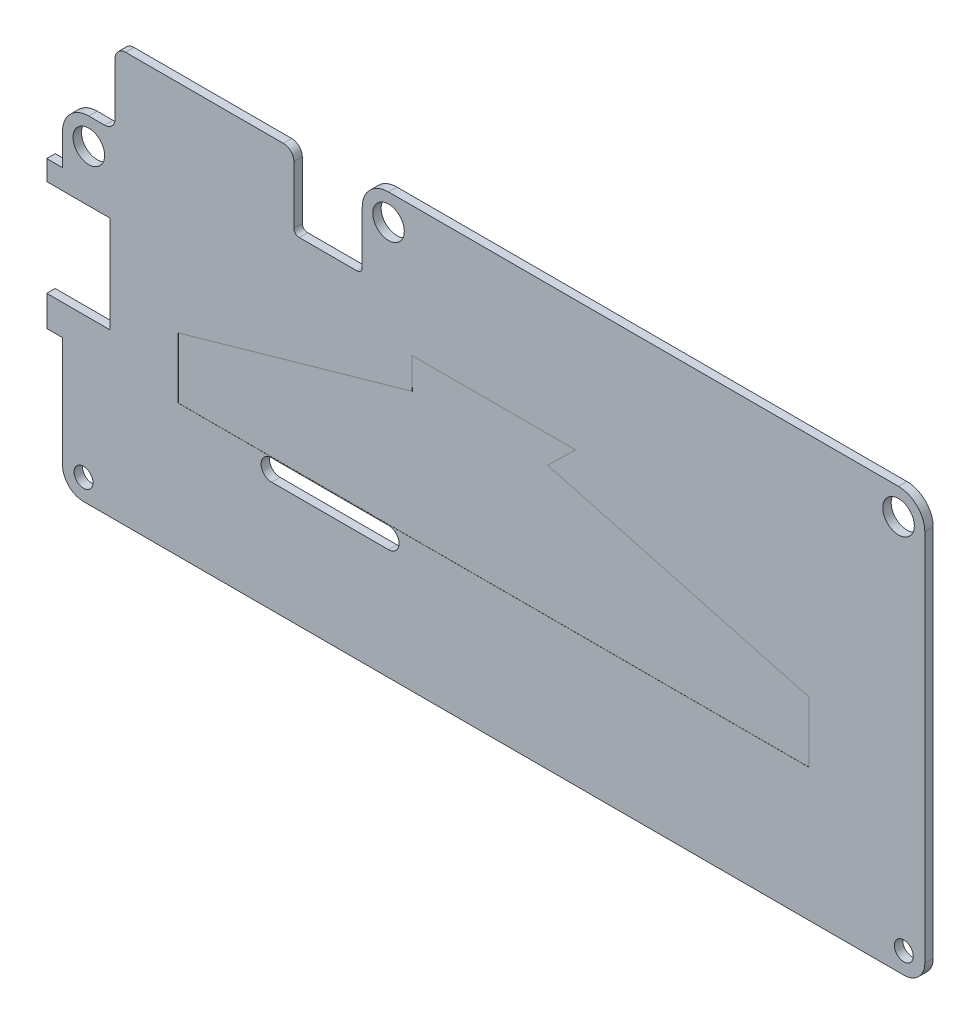
from build123d import *

# Parameters (mm, degrees)
CUT_EXTRUDE_START         = -0.79
CUT_EXTRUDE_1_OUTLINE_R   = 0.8
CUT_EXTRUDE_1_DEPTH       = 0.79
CUT_EXTRUDE_START_2       = -0.8
CUT_EXTRUDE_1_2_OUTLINE_R = 0.8
CUT_EXTRUDE_1_2_DEPTH     = 0.01
FILLET_1_R                = 1
FILLET_2_R                = 0.5
SKETCH_4_W                = 1.5
SKETCH_4_H                = 3.564386262
SKETCH_4_W_2              = 3.353676254
SKETCH_4_H_2              = 1.5
SKETCH_4_W_3              = 4.922817729
SKETCH_4_H_3              = 6.405279273
EXTRUDE_1_DEPTH           = 0.8
FILLET_3_R                = 2.5
FILLET_4_R                = 2
HOLE_WIZARD_M1_6_1_D      = 1.8
SKETCH_6_R                = 1.5
CUT_EXTRUDE_2_DEPTH       = 47.977547829
SKETCH_7_W                = 1.5
SKETCH_7_H                = 1
CUT_EXTRUDE_3_DEPTH       = 47.977547829
SKETCH_8_W                = 4.6
SKETCH_8_H                = 2.2
EXTRUDE_2_DEPTH           = 0.85
CUT_EXTRUDE_4_DEPTH       = 0.1


with BuildPart() as part:
    # 切除-拉伸1: read off the stored shape, not the designer's step
    # 切除-拉伸1 outline → 切除-拉伸1 (new body)
    with BuildSketch(Plane(origin=(0, 0, 0), x_dir=(-1, 0, 0), z_dir=(0, 0, -1)).offset(CUT_EXTRUDE_START)):
        with BuildLine():
            Line((41, 7.5), (41, 12))
            Line((41, 12), (36, 12))
            Line((36, 12), (36, 19))
            Line((36, 19), (19, 19))
            Line((19, 19), (19, 12))
            Line((19, 12), (12.5, 12))
            Line((12.5, 12), (12.5, 20))
            Line((12.5, 20), (-39.5, 20))
            ThreePointArc((-39.5, 20), (-40.560660172, 19.560660172), (-41, 18.5))
            Line((-41, 18.5), (-41, -18.5))
            ThreePointArc((-41, -18.5), (-40.560660172, -19.560660172), (-39.5, -20))
            Line((-39.5, -20), (39.5, -20))
            ThreePointArc((39.5, -20), (40.560660172, -19.560660172), (41, -18.5))
            Line((41, -18.5), (41, -7.5))
            Line((41, -7.5), (42.5, -7.5))
            Line((42.5, -7.5), (42.5, -4.6))
            Line((42.5, -4.6), (36.5, -4.6))
            Line((36.5, -4.6), (36.5, 4.6))
            Line((36.5, 4.6), (42.5, 4.6))
            Line((42.5, 4.6), (42.5, 7.5))
            Line((42.5, 7.5), (41, 7.5))
        make_face()
        with BuildLine():
            ThreePointArc((10, -9.46), (9, -8.46), (10, -7.46))
            Line((10, -7.46), (21.119596141, -7.46))
            ThreePointArc((21.119596141, -7.46), (22.119596141, -8.46), (21.119596141, -9.46))
            Line((21.119596141, -9.46), (10, -9.46))
        make_face(mode=Mode.SUBTRACT)
        with Locations((-39, 17.8)):
            Circle(CUT_EXTRUDE_1_OUTLINE_R, mode=Mode.SUBTRACT)
    extrude(amount=CUT_EXTRUDE_1_DEPTH)

    # Cut-Extrude 1 2 outline → Cut-Extrude 1 2 (add)
    with BuildSketch(Plane(origin=(0, 0, 0), x_dir=(-1, 0, 0), z_dir=(0, 0, -1)).offset(CUT_EXTRUDE_START_2)):
        with BuildLine():
            Line((41, 7.5), (41, 12))
            Line((41, 12), (36, 12))
            Line((36, 12), (36, 19))
            Line((36, 19), (19, 19))
            Line((19, 19), (19, 12))
            Line((19, 12), (12.5, 12))
            Line((12.5, 12), (12.5, 20))
            Line((12.5, 20), (-39.5, 20))
            ThreePointArc((-39.5, 20), (-40.560660172, 19.560660172), (-41, 18.5))
            Line((-41, 18.5), (-41, -18.5))
            ThreePointArc((-41, -18.5), (-40.560660172, -19.560660172), (-39.5, -20))
            Line((-39.5, -20), (39.5, -20))
            ThreePointArc((39.5, -20), (40.560660172, -19.560660172), (41, -18.5))
            Line((41, -18.5), (41, -7.5))
            Line((41, -7.5), (42.5, -7.5))
            Line((42.5, -7.5), (42.5, -4.6))
            Line((42.5, -4.6), (36.5, -4.6))
            Line((36.5, -4.6), (36.5, 4.6))
            Line((36.5, 4.6), (42.5, 4.6))
            Line((42.5, 4.6), (42.5, 7.5))
            Line((42.5, 7.5), (41, 7.5))
        make_face()
        with BuildLine():
            ThreePointArc((10, -9.46), (9, -8.46), (10, -7.46))
            Line((10, -7.46), (21.119596141, -7.46))
            ThreePointArc((21.119596141, -7.46), (22.119596141, -8.46), (21.119596141, -9.46))
            Line((21.119596141, -9.46), (10, -9.46))
        make_face(mode=Mode.SUBTRACT)
        Polygon((-7.785, 7.65), (7.785, 7.65), (7.75, 4.705352673), (30, -1.607444679), (30, -7.391218927), (-30, -7.391218927), (-30, -1.607444679), (-5.123684283, 5.056053824), align=None, mode=Mode.SUBTRACT)
        with Locations((-39, 17.8)):
            Circle(CUT_EXTRUDE_1_2_OUTLINE_R, mode=Mode.SUBTRACT)
    extrude(amount=CUT_EXTRUDE_1_2_DEPTH)

    # 圆角1
    fillet_1_edges = [part.edges().sort_by_distance(p)[0] for p in [
        (-36, 12, 0.4),
        (-19, 19, 0.4),
        (-36, 19, 0.4),
    ]]
    fillet(fillet_1_edges, radius=FILLET_1_R)

    # 圆角2
    fillet_2_edges = [part.edges().sort_by_distance(p)[0] for p in [
        (-19, 12, 0.4),
        (-12.5, 12, 0.4),
    ]]
    fillet(fillet_2_edges, radius=FILLET_2_R)

    # 草图4 → 凸台-拉伸1 (add)
    with BuildSketch(Plane(origin=(0, 0, 0), x_dir=(-1, 0, 0), z_dir=(0, 0, -1))):
        with Locations((-40.25, -18.217806869)):
            Rectangle(SKETCH_4_W, SKETCH_4_H)
        with Locations((39.323161873, -19.25)):
            Rectangle(SKETCH_4_W_2, SKETCH_4_H_2)
        with Locations((-38.538591135, 16.797360364)):
            Rectangle(SKETCH_4_W_3, SKETCH_4_H_3)
    extrude(amount=-EXTRUDE_1_DEPTH)

    # 圆角3
    fillet_3_edges = [part.edges().sort_by_distance(p)[0] for p in [
        (-41, 12, 0.4),
        (41, 20, 0.4),
        (-12.5, 20, 0.4),
    ]]
    fillet(fillet_3_edges, radius=FILLET_3_R)

    # 圆角4
    fillet_4_edges = [part.edges().sort_by_distance(p)[0] for p in [
        (41, -20, 0.4),
        (-41, -20, 0.4),
    ]]
    fillet(fillet_4_edges, radius=FILLET_4_R)

    # M1.6 间隙孔1 (through all)
    with Locations(Plane(origin=(0, 0, 0), x_dir=(-1, 0, 0), z_dir=(0, 0, -1))):
        with Locations((-38.5, 17.5), (10, 17.5), (38.5, 9.5), (-39, -18), (39, -18)):
            Hole(HOLE_WIZARD_M1_6_1_D / 2)

    # 草图6 → 切除-拉伸2 (cut, through all)
    with BuildSketch(Plane(origin=(0, 0, 0), x_dir=(-1, 0, 0), z_dir=(0, 0, -1))):
        with Locations((-38.5, 17.5)):
            Circle(SKETCH_6_R)
        with Locations((10, 17.5)):
            Circle(SKETCH_6_R)
        with Locations((38.5, 9.5)):
            Circle(SKETCH_6_R)
    extrude(amount=-CUT_EXTRUDE_2_DEPTH, mode=Mode.SUBTRACT)

    # 草图7 → 切除-拉伸3 (cut, through all)
    with BuildSketch(Plane(origin=(0, 0, 0), x_dir=(-1, 0, 0), z_dir=(0, 0, -1))):
        with Locations((41.75, 7)):
            Rectangle(SKETCH_7_W, SKETCH_7_H)
    extrude(amount=-CUT_EXTRUDE_3_DEPTH, mode=Mode.SUBTRACT)

    # 草图8 → 凸台-拉伸2 (add)
    with BuildSketch(Plane(origin=(0, 0, 0), x_dir=(-1, 0, 0), z_dir=(0, 0, -1))):
        with Locations((11.25, -12.06)):
            Rectangle(SKETCH_8_W, SKETCH_8_H)
        with Locations((18.25, -12.06)):
            Rectangle(SKETCH_8_W, SKETCH_8_H)
    extrude(amount=EXTRUDE_2_DEPTH)

    # 草图9 → 切除-拉伸4 (cut)
    with BuildSketch(Plane(origin=(0, 0, 0), x_dir=(-1, 0, 0), z_dir=(0, 0, -1))):
        Polygon((9.05640906, -13.347097503), (9.241304893, -13.347097503), (9.241304893, -14.347097503), (9.151561304, -14.347097503), (9.151561304, -13.449661605), (8.99771515, -13.449661605), align=None)
        with BuildLine():
            Line((13.702843355, -13.347097503), (13.702843355, -13.449661605))
            Line((13.702843355, -13.449661605), (13.362699124, -13.449661605))
            Line((13.362699124, -13.449661605), (13.308812906, -13.712682439))
            add(Edge.make_bspline(
                [(13.308812906, -13.712682439), (13.319400299, -13.709759504), (13.339911698, -13.70409678), (13.370185944, -13.697809417), (13.398926573, -13.69401929), (13.417576679, -13.693501773), (13.426601368, -13.693251349)],
                knots=[0, 0, 0, 0, 1.100273476, 2.13160584, 3.095893838, 4, 4, 4, 4], degree=3))
            add(Edge.make_bspline(
                [(13.426601368, -13.693251349), (13.43776815, -13.693493045), (13.459724835, -13.693968279), (13.491850249, -13.698531665), (13.52251679, -13.705714498), (13.551660324, -13.715748932), (13.579334767, -13.728580285), (13.605285499, -13.744608839), (13.629902046, -13.763332648), (13.652742787, -13.784859794), (13.673464018, -13.808551685), (13.691682872, -13.834025362), (13.707157898, -13.861033266), (13.719603828, -13.88983344), (13.729542209, -13.920107483), (13.736157064, -13.952173936), (13.740561838, -13.985730541), (13.741053949, -14.008674704), (13.741304893, -14.020374746)],
                knots=[0, 0, 0, 0, 1.052922333, 2.070308379, 3.05430497, 4.020497103, 4.973039431, 5.925935799, 6.892292201, 7.88610001, 8.88166317, 9.857072816, 10.836096531, 11.812156883, 12.81219415, 13.836441305, 14.89672472, 16, 16, 16, 16], degree=3))
            add(Edge.make_bspline(
                [(13.741304893, -14.020374746), (13.741114872, -14.028523952), (13.740737397, -14.044712234), (13.7388178, -14.068753434), (13.735121881, -14.092285672), (13.730159675, -14.11531207), (13.723718984, -14.137789034), (13.715922111, -14.159780899), (13.706380389, -14.181150786), (13.695914282, -14.202100899), (13.684129574, -14.222157616), (13.67105, -14.240914469), (13.657231288, -14.258652835), (13.642362321, -14.275182473), (13.626304894, -14.290394764), (13.609253475, -14.304379987), (13.591344127, -14.317374653), (13.572299772, -14.32885128), (13.552544777, -14.339412125), (13.531793857, -14.348075993), (13.510519372, -14.355821858), (13.488415121, -14.361996008), (13.465531175, -14.366833881), (13.44182981, -14.370119767), (13.417435333, -14.372513035), (13.400899615, -14.372662851), (13.392546881, -14.372738528)],
                knots=[0, 0, 0, 0, 1.056347294, 2.098418968, 3.122841568, 4.141288669, 5.149314143, 6.15115421, 7.162517403, 8.180376062, 9.185164535, 10.17417709, 11.141909838, 12.097768115, 13.052685741, 14.0056014, 14.954263652, 15.917497458, 16.885230207, 17.854509472, 18.828990115, 19.81800267, 20.826176721, 21.857883937, 22.917946725, 24, 24, 24, 24], degree=3))
            add(Edge.make_bspline(
                [(13.392546881, -14.372738528), (13.382582829, -14.372541146), (13.362979734, -14.37215282), (13.334259572, -14.368090395), (13.306626828, -14.362272134), (13.280303942, -14.353518914), (13.255055009, -14.342551115), (13.231219947, -14.328689352), (13.208189725, -14.312981036), (13.186900572, -14.294443793), (13.167141682, -14.274182169), (13.149454109, -14.252194272), (13.133701658, -14.228843003), (13.120136587, -14.204014959), (13.108565724, -14.177775378), (13.099475728, -14.15002595), (13.092139055, -14.120911663), (13.08903522, -14.100867803), (13.087458739, -14.090687246)],
                knots=[0, 0, 0, 0, 1.0467383, 2.05933395, 3.04377827, 4.011590433, 4.970194871, 5.932262533, 6.905835911, 7.896367577, 8.894135286, 9.877477877, 10.858688626, 11.851381753, 12.8477658, 13.868841284, 14.917554742, 16, 16, 16, 16], degree=3))
            Line((13.087458739, -14.090687246), (13.177202329, -14.090687246))
            add(Edge.make_bspline(
                [(13.177202329, -14.090687246), (13.179410488, -14.100223376), (13.183654693, -14.118552345), (13.192970621, -14.144304157), (13.204360872, -14.167252507), (13.217904971, -14.187700959), (13.234062123, -14.205532101), (13.252499102, -14.22142269), (13.27316988, -14.235758442), (13.296139375, -14.247707804), (13.320371683, -14.257898876), (13.345733743, -14.264685075), (13.371534985, -14.269456758), (13.388985948, -14.269934404), (13.397755214, -14.270174426)],
                knots=[0, 0, 0, 0, 1.136247022, 2.183929868, 3.172523383, 4.106158343, 5.02341133, 5.958108904, 6.928429099, 7.938127109, 8.96079061, 9.975095812, 10.982467395, 12, 12, 12, 12], degree=3))
            add(Edge.make_bspline(
                [(13.397755214, -14.270174426), (13.406314769, -14.269939918), (13.423168604, -14.26947817), (13.447971858, -14.265924166), (13.471918393, -14.260450574), (13.494771924, -14.252259187), (13.516932364, -14.242303553), (13.537839155, -14.229527817), (13.55809712, -14.214824955), (13.577076587, -14.197980204), (13.594459286, -14.179417434), (13.609818178, -14.15956675), (13.622611582, -14.138390508), (13.633392756, -14.116255321), (13.641579413, -14.092918591), (13.647419693, -14.068489684), (13.650849139, -14.042908261), (13.651320904, -14.025459887), (13.651561304, -14.016568657)],
                knots=[0, 0, 0, 0, 1.027316725, 2.022795036, 3.002884548, 3.971462791, 4.93288096, 5.914575861, 6.907176829, 7.935150275, 8.956128384, 9.956726525, 10.942570165, 11.921478529, 12.907843606, 13.90538589, 14.932640048, 16, 16, 16, 16], degree=3))
            add(Edge.make_bspline(
                [(13.651561304, -14.016568657), (13.651373167, -14.008547013), (13.651004915, -13.992845788), (13.647996181, -13.969874586), (13.64276276, -13.948139431), (13.635498794, -13.927535364), (13.626276078, -13.908042952), (13.615005703, -13.889642078), (13.601476161, -13.872575268), (13.586021335, -13.856834539), (13.569090467, -13.842307431), (13.550392254, -13.829923407), (13.53031799, -13.819505145), (13.509109533, -13.810514288), (13.486262419, -13.804056932), (13.462229095, -13.799208965), (13.436750036, -13.796404575), (13.419329839, -13.796015465), (13.410375406, -13.795815451)],
                knots=[0, 0, 0, 0, 1.045622112, 2.046656509, 3.013763289, 3.955457236, 4.890082067, 5.820317437, 6.762574623, 7.722996705, 8.69280354, 9.665887285, 10.63943826, 11.638615906, 12.663482002, 13.728887084, 14.832589034, 16, 16, 16, 16], degree=3))
            add(Edge.make_bspline(
                [(13.410375406, -13.795815451), (13.402624284, -13.795981335), (13.386620182, -13.796323841), (13.362070803, -13.798845698), (13.336273168, -13.802914067), (13.309326169, -13.808510138), (13.281148881, -13.815833303), (13.251800767, -13.824608874), (13.221220119, -13.835100874), (13.200615055, -13.843024364), (13.190022842, -13.847097503)],
                knots=[0, 0, 0, 0, 0.817624296, 1.688186739, 2.600797293, 3.572016777, 4.590301741, 5.671205678, 6.80286297, 8, 8, 8, 8], degree=3))
            Line((13.190022842, -13.847097503), (13.292586945, -13.347097503))
            Line((13.292586945, -13.347097503), (13.702843355, -13.347097503))
        make_face()
        Polygon((15.594870598, -13.347097503), (15.779766432, -13.347097503), (15.779766432, -14.347097503), (15.690022842, -14.347097503), (15.690022842, -13.449661605), (15.536176688, -13.449661605), align=None)
        with BuildLine():
            Line((21.010535663, -13.347097503), (21.010535663, -13.449661605))
            Line((21.010535663, -13.449661605), (20.670391432, -13.449661605))
            Line((20.670391432, -13.449661605), (20.616505214, -13.712682439))
            add(Edge.make_bspline(
                [(20.616505214, -13.712682439), (20.627092607, -13.709759504), (20.647604005, -13.70409678), (20.677878251, -13.697809417), (20.706618881, -13.69401929), (20.725268987, -13.693501773), (20.734293675, -13.693251349)],
                knots=[0, 0, 0, 0, 1.100273476, 2.13160584, 3.095893838, 4, 4, 4, 4], degree=3))
            add(Edge.make_bspline(
                [(20.734293675, -13.693251349), (20.745460458, -13.693493045), (20.767417143, -13.693968279), (20.799542557, -13.698531665), (20.830209097, -13.705714498), (20.859352632, -13.715748932), (20.887027075, -13.728580285), (20.912977807, -13.744608839), (20.937594353, -13.763332648), (20.960435094, -13.784859794), (20.981156325, -13.808551685), (20.999375179, -13.834025362), (21.014850205, -13.861033266), (21.027296135, -13.88983344), (21.037234516, -13.920107483), (21.043849372, -13.952173936), (21.048254146, -13.985730541), (21.048746257, -14.008674704), (21.048997201, -14.020374746)],
                knots=[0, 0, 0, 0, 1.052922333, 2.070308379, 3.05430497, 4.020497103, 4.973039431, 5.925935799, 6.892292201, 7.88610001, 8.88166317, 9.857072816, 10.836096531, 11.812156883, 12.81219415, 13.836441305, 14.89672472, 16, 16, 16, 16], degree=3))
            add(Edge.make_bspline(
                [(21.048997201, -14.020374746), (21.04880718, -14.028523952), (21.048429704, -14.044712234), (21.046510108, -14.068753434), (21.042814189, -14.092285672), (21.037851982, -14.11531207), (21.031411291, -14.137789034), (21.023614419, -14.159780899), (21.014072697, -14.181150786), (21.00360659, -14.202100899), (20.991821881, -14.222157616), (20.978742308, -14.240914469), (20.964923596, -14.258652835), (20.950054629, -14.275182473), (20.933997202, -14.290394764), (20.916945783, -14.304379987), (20.899036434, -14.317374653), (20.879992079, -14.32885128), (20.860237084, -14.339412125), (20.839486165, -14.348075993), (20.818211679, -14.355821858), (20.796107429, -14.361996008), (20.773223483, -14.366833881), (20.749522118, -14.370119767), (20.725127641, -14.372513035), (20.708591923, -14.372662851), (20.700239188, -14.372738528)],
                knots=[0, 0, 0, 0, 1.056347294, 2.098418968, 3.122841568, 4.141288669, 5.149314143, 6.15115421, 7.162517403, 8.180376062, 9.185164535, 10.17417709, 11.141909838, 12.097768115, 13.052685741, 14.0056014, 14.954263652, 15.917497458, 16.885230207, 17.854509472, 18.828990115, 19.81800267, 20.826176721, 21.857883937, 22.917946725, 24, 24, 24, 24], degree=3))
            add(Edge.make_bspline(
                [(20.700239188, -14.372738528), (20.690275137, -14.372541146), (20.670672042, -14.37215282), (20.64195188, -14.368090395), (20.614319136, -14.362272134), (20.58799625, -14.353518914), (20.562747317, -14.342551115), (20.538912255, -14.328689352), (20.515882033, -14.312981036), (20.49459288, -14.294443793), (20.47483399, -14.274182169), (20.457146416, -14.252194272), (20.441393966, -14.228843003), (20.427828895, -14.204014959), (20.416258032, -14.177775378), (20.407168035, -14.15002595), (20.399831362, -14.120911663), (20.396727528, -14.100867803), (20.395151047, -14.090687246)],
                knots=[0, 0, 0, 0, 1.0467383, 2.05933395, 3.04377827, 4.011590433, 4.970194871, 5.932262533, 6.905835911, 7.896367577, 8.894135286, 9.877477877, 10.858688626, 11.851381753, 12.8477658, 13.868841284, 14.917554742, 16, 16, 16, 16], degree=3))
            Line((20.395151047, -14.090687246), (20.484894637, -14.090687246))
            add(Edge.make_bspline(
                [(20.484894637, -14.090687246), (20.487102796, -14.100223376), (20.491347001, -14.118552345), (20.500662929, -14.144304157), (20.512053179, -14.167252507), (20.525597279, -14.187700959), (20.54175443, -14.205532101), (20.56019141, -14.22142269), (20.580862188, -14.235758442), (20.603831682, -14.247707804), (20.628063991, -14.257898876), (20.653426051, -14.264685075), (20.679227292, -14.269456758), (20.696678255, -14.269934404), (20.705447522, -14.270174426)],
                knots=[0, 0, 0, 0, 1.136247022, 2.183929868, 3.172523383, 4.106158343, 5.02341133, 5.958108904, 6.928429099, 7.938127109, 8.96079061, 9.975095812, 10.982467395, 12, 12, 12, 12], degree=3))
            add(Edge.make_bspline(
                [(20.705447522, -14.270174426), (20.714007077, -14.269939918), (20.730860912, -14.26947817), (20.755664165, -14.265924166), (20.779610701, -14.260450574), (20.802464231, -14.252259187), (20.824624671, -14.242303553), (20.845531463, -14.229527817), (20.865789428, -14.214824955), (20.884768894, -14.197980204), (20.902151594, -14.179417434), (20.917510486, -14.15956675), (20.93030389, -14.138390508), (20.941085064, -14.116255321), (20.949271721, -14.092918591), (20.955112001, -14.068489684), (20.958541446, -14.042908261), (20.959013212, -14.025459887), (20.959253611, -14.016568657)],
                knots=[0, 0, 0, 0, 1.027316725, 2.022795036, 3.002884548, 3.971462791, 4.93288096, 5.914575861, 6.907176829, 7.935150275, 8.956128384, 9.956726525, 10.942570165, 11.921478529, 12.907843606, 13.90538589, 14.932640048, 16, 16, 16, 16], degree=3))
            add(Edge.make_bspline(
                [(20.959253611, -14.016568657), (20.959065474, -14.008547013), (20.958697223, -13.992845788), (20.955688489, -13.969874586), (20.950455068, -13.948139431), (20.943191102, -13.927535364), (20.933968386, -13.908042952), (20.922698011, -13.889642078), (20.909168468, -13.872575268), (20.893713643, -13.856834539), (20.876782774, -13.842307431), (20.858084562, -13.829923407), (20.838010297, -13.819505145), (20.81680184, -13.810514288), (20.793954726, -13.804056932), (20.769921403, -13.799208965), (20.744442344, -13.796404575), (20.727022147, -13.796015465), (20.718067714, -13.795815451)],
                knots=[0, 0, 0, 0, 1.045622112, 2.046656509, 3.013763289, 3.955457236, 4.890082067, 5.820317437, 6.762574623, 7.722996705, 8.69280354, 9.665887285, 10.63943826, 11.638615906, 12.663482002, 13.728887084, 14.832589034, 16, 16, 16, 16], degree=3))
            add(Edge.make_bspline(
                [(20.718067714, -13.795815451), (20.710316591, -13.795981335), (20.69431249, -13.796323841), (20.669763111, -13.798845698), (20.643965476, -13.802914067), (20.617018477, -13.808510138), (20.588841189, -13.815833303), (20.559493074, -13.824608874), (20.528912427, -13.835100874), (20.508307363, -13.843024364), (20.49771515, -13.847097503)],
                knots=[0, 0, 0, 0, 0.817624296, 1.688186739, 2.600797293, 3.572016777, 4.590301741, 5.671205678, 6.80286297, 8, 8, 8, 8], degree=3))
            Line((20.49771515, -13.847097503), (20.600279252, -13.347097503))
            Line((20.600279252, -13.347097503), (21.010535663, -13.347097503))
        make_face()
    extrude(amount=-CUT_EXTRUDE_4_DEPTH, mode=Mode.SUBTRACT)


solid = part.part
